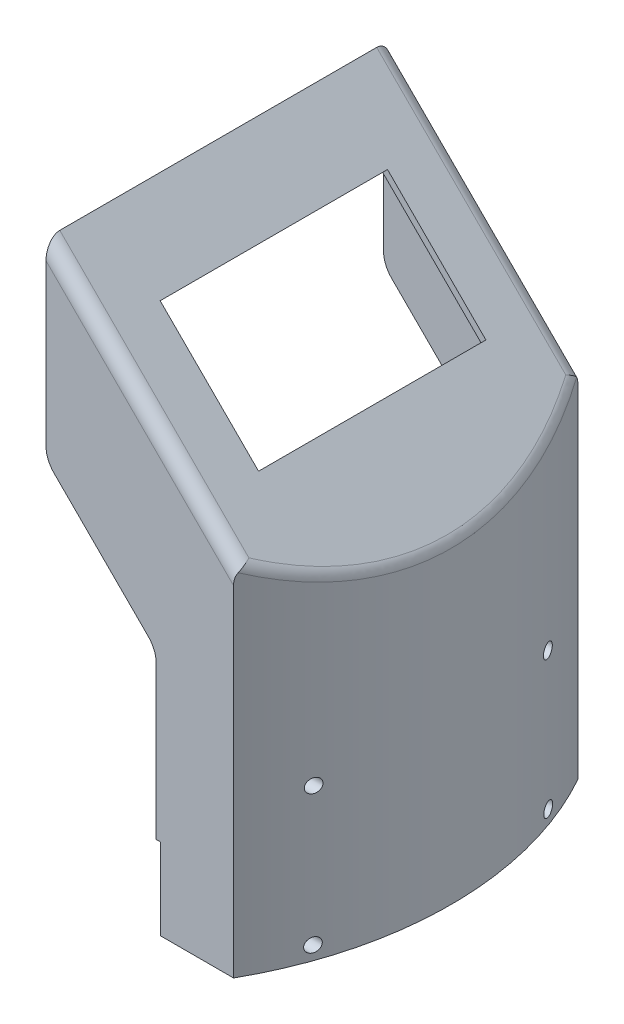
from build123d import *
from build123d.topology import SkipClean

# Parameters (mm, degrees)
SKETCH1_R            = 254.5
SKETCH1_R_2          = 234.5
BOSS_EXTRUDE1_DEPTH  = 5
BOSS_EXTRUDE2_DEPTH  = 500
SKETCH3_W            = 27.805822748
SKETCH3_H            = 60
CUT_EXTRUDE1_DEPTH   = 500
SKETCH4_R            = 250.5
CUT_EXTRUDE2_DEPTH   = 500
BOSS_EXTRUDE3_DEPTH  = 500
BOSS_EXTRUDE4_DEPTH  = 5
SKETCH11_W           = 24.416490723
SKETCH11_H           = 190
CUT_EXTRUDE3_DEPTH   = 10
CUT_EXTRUDE4_DEPTH   = 10
FILLET1_R            = 5
SKETCH15_R           = 2.5
CUT_EXTRUDE5_DEPTH   = 10
BOSS_EXTRUDE5_DEPTH  = 3
SKETCH18_R           = 2.5
CUT_EXTRUDE6_DEPTH   = 5
CUT_EXTRUDE7_DEPTH   = 7
FILLET2_R            = 5
SKETCH21_R           = 2.5
CUT_EXTRUDE8_DEPTH   = 10
SKETCH24_W           = 28.197779234
SKETCH24_H           = 25
CUT_EXTRUDE11_DEPTH  = 45
FILLET3_R            = 2
SKETCH25_R           = 315.993066883
CUT_EXTRUDE12_DEPTH  = 277
BOSS_EXTRUDE6_START  = -150
BOSS_EXTRUDE6_DEPTH  = 150
BOSS_EXTRUDE8_DEPTH  = 228
BOSS_EXTRUDE9_DEPTH  = 125
CUT_EXTRUDE15_DEPTH  = 250
SKETCH35_R           = 2.5
CUT_EXTRUDE16_DEPTH  = 10
CUT_EXTRUDE18_DEPTH  = 120
CUT_EXTRUDE19_DEPTH  = 369
BOSS_EXTRUDE10_DEPTH = 228
SKETCH36_R           = 5
CUT_EXTRUDE17_DEPTH  = 110
FILLET5_R            = 10
FILLET7_R            = 10
SKETCH43_W           = 165
SKETCH43_H           = 101
CUT_EXTRUDE20_DEPTH  = 10
FILLET8_R            = 10
BOSS_EXTRUDE12_DEPTH = 5
FILLET9_R            = 20
SKETCH46_W           = 3
SKETCH46_H           = 59
CUT_EXTRUDE21_DEPTH  = 5


with BuildPart() as part:
    # Sketch1 → Boss-Extrude1 (new body)
    with BuildSketch(Plane(origin=(0, 0, 0), x_dir=(1, 0, 0), z_dir=(0, 1, 0))):
        Circle(SKETCH1_R)
        Circle(SKETCH1_R_2, mode=Mode.SUBTRACT)
    extrude(amount=BOSS_EXTRUDE1_DEPTH)

    # Sketch2 → Boss-Extrude2 (add)
    with SkipClean():  # the faces are left unmerged after this step: merging them gives an invalid solid
        with BuildSketch(Plane(origin=(0, 5, 0), x_dir=(1, 0, 0), z_dir=(0, 1, 0))):
            with BuildLine():
                Line((234.5, 0), (254.5, 0))
                ThreePointArc((254.5, 0), (246.16017417, 64.617479467), (221.687279743, 125))
                Line((221.687279743, 125), (198.406779118, 125))
                ThreePointArc((198.406779118, 125), (225.296071541, 65.053286992), (234.5, 0))
            make_face()
        boss_extrude2 = extrude(amount=BOSS_EXTRUDE2_DEPTH)

    # Mirror1: Boss-Extrude2 across plane
    add(boss_extrude2.mirror(Plane(origin=(0, 505, 0), x_dir=(1, 0, 0), z_dir=(0, 0, 1))))

    # Sketch3 → Cut-Extrude1 (cut)
    with SkipClean():  # the faces are left unmerged after this step: merging them gives an invalid solid
        with BuildSketch(Plane(origin=(0, 5, 0), x_dir=(1, 0, 0), z_dir=(0, 1, 0))):
            with Locations((-240.597088626, 30)):
                Rectangle(SKETCH3_W, SKETCH3_H)
        cut_extrude1 = extrude(amount=-CUT_EXTRUDE1_DEPTH, mode=Mode.SUBTRACT)

    # Mirror2: Cut-Extrude1 across plane
    with SkipClean():  # the faces are left unmerged after this step: merging them gives an invalid solid
        add(cut_extrude1.mirror(Plane.XY), mode=Mode.SUBTRACT)

    # Sketch4 → Cut-Extrude2 (cut)
    with BuildSketch(Plane(origin=(0, 505, 0), x_dir=(1, 0, 0), z_dir=(0, 1, 0))):
        Circle(SKETCH4_R)
    extrude(amount=-CUT_EXTRUDE2_DEPTH, mode=Mode.SUBTRACT)

    # Sketch8 → Boss-Extrude3 (add)
    with BuildSketch(Plane(origin=(0, 5, 0), x_dir=(1, 0, 0), z_dir=(0, 1, 0))):
        Polygon((217.083509277, 125), (165.583509277, 125), (165.583509277, 120), (220.045796136, 120), (220.045796136, 125), align=None)
    boss_extrude3 = extrude(amount=BOSS_EXTRUDE3_DEPTH)

    # Mirror3: Boss-Extrude3 across plane
    add(boss_extrude3.mirror(Plane.XY))

    # Sketch10 → Boss-Extrude4 (add)
    with BuildSketch(Plane.XZ):
        with BuildLine():
            Line((198.406779118, 125), (165.583509277, 125))
            Line((165.583509277, 125), (165.583509277, -125))
            Line((165.583509277, -125), (198.406779118, -125))
            ThreePointArc((198.406779118, -125), (234.5, 0), (198.406779118, 125))
        make_face()
    extrude(amount=-BOSS_EXTRUDE4_DEPTH)

    # Sketch11 → Cut-Extrude3 (cut)
    with BuildSketch(Plane(origin=(0, 5, 0), x_dir=(1, 0, 0), z_dir=(0, 1, 0))):
        with Locations((177.791754639, -1.5)):
            Rectangle(SKETCH11_W, SKETCH11_H)
    extrude(amount=-CUT_EXTRUDE3_DEPTH, mode=Mode.SUBTRACT)

    # Sketch12 → Cut-Extrude4 (cut)
    with BuildSketch(Plane(origin=(0, 5, 0), x_dir=(1, 0, 0), z_dir=(0, 1, 0))):
        with BuildLine():
            Line((213, -75), (190, -75))
            Line((190, -75), (190, -93.5))
            Line((190, -93.5), (213, -93.5))
            ThreePointArc((213, -93.5), (216.535533906, -92.035533906), (218, -88.5))
            Line((218, -88.5), (218, -80))
            ThreePointArc((218, -80), (216.535533906, -76.464466094), (213, -75))
        make_face()
        with BuildLine():
            Line((213, 93.5), (190, 93.5))
            Line((190, 93.5), (190, 75))
            Line((190, 75), (213, 75))
            ThreePointArc((213, 75), (216.535533906, 76.464466094), (218, 80))
            Line((218, 80), (218, 88.5))
            ThreePointArc((218, 88.5), (216.535533906, 92.035533906), (213, 93.5))
        make_face()
        with BuildLine():
            Line((185, 120), (165.583509277, 120))
            Line((165.583509277, 120), (165.583509277, 93.5))
            Line((165.583509277, 93.5), (190, 93.5))
            Line((190, 93.5), (190, 115))
            ThreePointArc((190, 115), (188.535533906, 118.535533906), (185, 120))
        make_face()
        with BuildLine():
            Line((190, -115), (190, -96.5))
            Line((190, -96.5), (165.583509277, -96.5))
            Line((165.583509277, -96.5), (165.583509277, -120))
            Line((165.583509277, -120), (185, -120))
            ThreePointArc((185, -120), (188.535533906, -118.535533906), (190, -115))
        make_face()
    extrude(amount=-CUT_EXTRUDE4_DEPTH, mode=Mode.SUBTRACT)

    # Fillet1
    fillet1_edges = [part.edges().sort_by_distance(p)[0] for p in [
        (190, 2.5, 93.5),
        (190, 2.5, -93.5),
        (190, 2.5, -75),
        (190, 2.5, 75),
    ]]
    fillet(fillet1_edges, radius=FILLET1_R)

    # Sketch15 → Cut-Extrude5 (cut)
    with BuildSketch(Plane(origin=(0, 5, 0), x_dir=(1, 0, 0), z_dir=(0, 1, 0))):
        with Locations((242.5, 0)):
            Circle(SKETCH15_R)
        with Locations((196.186621136, -142.537923681)):
            Circle(SKETCH15_R)
        with Locations((74.936621136, -230.631205202)):
            Circle(SKETCH15_R)
        with Locations((-74.936621136, -230.631205202)):
            Circle(SKETCH15_R)
        with Locations((-196.186621136, -142.537923681)):
            Circle(SKETCH15_R)
        with Locations((-242.5, 0)):
            Circle(SKETCH15_R)
        with Locations((-196.186621136, 142.537923681)):
            Circle(SKETCH15_R)
        with Locations((-74.936621136, 230.631205202)):
            Circle(SKETCH15_R)
        with Locations((74.936621136, 230.631205202)):
            Circle(SKETCH15_R)
        with Locations((196.186621136, 142.537923681)):
            Circle(SKETCH15_R)
    extrude(amount=-CUT_EXTRUDE5_DEPTH, mode=Mode.SUBTRACT)

    # Sketch16 → Boss-Extrude5 (add)
    with BuildSketch(Plane(origin=(0, 5, 0), x_dir=(1, 0, 0), z_dir=(0, 1, 0))):
        with BuildLine():
            Line((-247.326201604, 60), (-244.238101041, 60))
            ThreePointArc((-244.238101041, 60), (-35.003834494, 249.052166364), (218.236683443, 125))
            Line((218.236683443, 125), (221.687279743, 125))
            ThreePointArc((221.687279743, 125), (-34.936922855, 252.090581779), (-247.326201604, 60))
        make_face()
        with BuildLine():
            Line((221.687279743, -125), (218.236683443, -125))
            ThreePointArc((218.236683443, -125), (-35.003834494, -249.052166364), (-244.238101041, -60))
            Line((-244.238101041, -60), (-247.326201604, -60))
            ThreePointArc((-247.326201604, -60), (-34.936922855, -252.090581779), (221.687279743, -125))
        make_face()
    extrude(amount=BOSS_EXTRUDE5_DEPTH)

    # Sketch18 → Cut-Extrude6 (cut)
    with BuildSketch(Plane(origin=(0, 5, 0), x_dir=(1, 0, 0), z_dir=(0, 1, 0))):
        with Locations((0, -242.5)):
            Circle(SKETCH18_R)
        with Locations((-142.537923681, -196.186621136)):
            Circle(SKETCH18_R)
        with Locations((-230.631205202, -74.936621136)):
            Circle(SKETCH18_R)
        with Locations((-230.631205202, 74.936621136)):
            Circle(SKETCH18_R)
        with Locations((-142.537923681, 196.186621136)):
            Circle(SKETCH18_R)
        with Locations((0, 242.5)):
            Circle(SKETCH18_R)
        with Locations((142.537923681, 196.186621136)):
            Circle(SKETCH18_R)
        with Locations((230.631205202, 74.936621136)):
            Circle(SKETCH18_R)
        with Locations((230.631205202, -74.936621136)):
            Circle(SKETCH18_R)
        with Locations((142.537923681, -196.186621136)):
            Circle(SKETCH18_R)
    extrude(amount=-CUT_EXTRUDE6_DEPTH, mode=Mode.SUBTRACT)

    # Sketch19 → Cut-Extrude7 (cut)
    with BuildSketch(Plane.XZ):
        with BuildLine():
            Line((193, 20), (207, 20))
            ThreePointArc((207, 20), (209.121320344, 19.121320344), (210, 17))
            Line((210, 17), (210, -17))
            ThreePointArc((210, -17), (209.121320344, -19.121320344), (207, -20))
            Line((207, -20), (193, -20))
            Line((193, -20), (190, -20))
            Line((190, -20), (190, -17))
            Line((190, -17), (190, 17))
            Line((190, 17), (190, 20))
            Line((190, 20), (193, 20))
        make_face()
    extrude(amount=-CUT_EXTRUDE7_DEPTH, mode=Mode.SUBTRACT)

    # Fillet2
    fillet2_edges = [part.edges().sort_by_distance(p)[0] for p in [
        (190, 2.5, 20),
        (190, 2.5, -20),
    ]]
    fillet(fillet2_edges, radius=FILLET2_R)

    # Sketch21 → Cut-Extrude8 (cut)
    with BuildSketch(Plane(origin=(0, 5, 0), x_dir=(1, 0, 0), z_dir=(0, 1, 0))):
        with Locations((200, 50)):
            Circle(SKETCH21_R)
        with Locations((200, -50)):
            Circle(SKETCH21_R)
    extrude(amount=-CUT_EXTRUDE8_DEPTH, mode=Mode.SUBTRACT)

    # Sketch24 → Cut-Extrude11 (cut, symmetric)
    with BuildSketch(Plane.XY):
        with Locations((254.5, 246.5)):
            Rectangle(SKETCH24_W, SKETCH24_H)
    extrude(amount=CUT_EXTRUDE11_DEPTH, both=True, mode=Mode.SUBTRACT)

    # Fillet3
    fillet3_edges = [part.edges().sort_by_distance(p)[0] for p in [
        (248.457478811, 259, 45),
        (248.457478811, 234, 45),
        (248.457478811, 234, -45),
        (248.457478811, 259, -45),
    ]]
    fillet(fillet3_edges, radius=FILLET3_R)

    # Sketch25 → Cut-Extrude12 (cut)
    with BuildSketch(Plane.XZ):
        Circle(SKETCH25_R)
    extrude(amount=-CUT_EXTRUDE12_DEPTH, mode=Mode.SUBTRACT)

    # Sketch26 → Boss-Extrude6 (add)
    with BuildSketch(Plane.XZ.offset(-277).offset(BOSS_EXTRUDE6_START)):
        with BuildLine():
            Line((188.583509277, -60), (188.583509277, -120))
            Line((188.583509277, -120), (219.886902748, -120))
            ThreePointArc((219.886902748, -120), (233.482930338, -90.752251987), (243.208244104, -60))
            Line((243.208244104, -60), (188.583509277, -60))
        make_face()
        with BuildLine():
            ThreePointArc((243.208244104, 60), (233.482930338, 90.752251987), (219.886902748, 120))
            Line((219.886902748, 120), (188.583509277, 120))
            Line((188.583509277, 120), (188.583509277, 60))
            Line((188.583509277, 60), (243.208244104, 60))
        make_face()
    extrude(amount=BOSS_EXTRUDE6_DEPTH)

    # Sketch30 → Boss-Extrude8 (add)
    with BuildSketch(Plane(origin=(0, 505, 0), x_dir=(1, 0, 0), z_dir=(0, 1, 0))):
        with BuildLine():
            ThreePointArc((219.886902748, -120), (250.5, 0), (219.886902748, 120))
            Line((219.886902748, 120), (217.605721432, 120))
            ThreePointArc((217.605721432, 120), (217.869046713, 119.521247), (218.131318694, 119.041916168))
            ThreePointArc((218.131318694, 119.041916168), (240.788166959, 61.427263103), (248.5, 0))
            ThreePointArc((248.5, 0), (240.788166959, -61.427263103), (218.131318694, -119.041916168))
            ThreePointArc((218.131318694, -119.041916168), (217.869046713, -119.521247), (217.605721432, -120))
            Line((217.605721432, -120), (219.886902748, -120))
        make_face()
    extrude(amount=-BOSS_EXTRUDE8_DEPTH)

    # Sketch33 → Boss-Extrude9 (add, symmetric)
    with BuildSketch(Plane.XY):
        Polygon((254.5, 505), (85.583509277, 673.916490723), (85.583509277, 505), (165.583509277, 505), align=None)
    extrude(amount=BOSS_EXTRUDE9_DEPTH, both=True)

    # Sketch34 → Cut-Extrude15 (cut)
    with BuildSketch(Plane(origin=(0, 505, 0), x_dir=(-1, 0, 0), z_dir=(0, -1, 0))):
        with BuildLine():
            Line((-254.5, -125), (-221.687279743, -125))
            ThreePointArc((-221.687279743, -125), (-246.16017417, -64.617479467), (-254.5, 0))
            Line((-254.5, 0), (-254.5, -125))
        make_face()
        with BuildLine():
            ThreePointArc((-254.5, 0), (-246.16017417, 64.617479467), (-221.687279743, 125))
            Line((-221.687279743, 125), (-254.5, 125))
            Line((-254.5, 125), (-254.5, 0))
        make_face()
    extrude(amount=-CUT_EXTRUDE15_DEPTH, mode=Mode.SUBTRACT)

    # Sketch35 → Cut-Extrude16 (cut)
    with BuildSketch(Plane.ZY.offset(-188.583509277)):
        with Locations((-85, 386.999350532)):
            Circle(SKETCH35_R)
        with Locations((-85.360407062, 287)):
            Circle(SKETCH35_R)
        with Locations((85.360407062, 287)):
            Circle(SKETCH35_R)
        with Locations((85, 386.999350532)):
            Circle(SKETCH35_R)
    extrude(amount=-CUT_EXTRUDE16_DEPTH, mode=Mode.SUBTRACT)

    # Sketch37 → Cut-Extrude18 (cut, symmetric)
    with BuildSketch(Plane.XY):
        Polygon((217.605721432, 534.823210756), (85.583509277, 666.845422911), (85.583509277, 505), (217.605721432, 505), align=None)
    extrude(amount=CUT_EXTRUDE18_DEPTH, both=True, mode=Mode.SUBTRACT)

    # Sketch40 → Cut-Extrude19 (cut)
    with BuildSketch(Plane(origin=(0, 0, -125), x_dir=(-1, 0, 0), z_dir=(0, 0, -1))):
        Polygon((-165.583509277, 505), (-85.583509277, 585), (-85.583509277, 505), align=None)
    extrude(amount=-CUT_EXTRUDE19_DEPTH, mode=Mode.SUBTRACT)

    # Sketch41 → Boss-Extrude10 (add)
    with BuildSketch(Plane.XZ.offset(-505)):
        with BuildLine():
            ThreePointArc((248.5, 0), (240.65252105, 61.956550195), (217.605721432, 120))
            Line((217.605721432, 120), (217.605721432, -120))
            ThreePointArc((217.605721432, -120), (240.65252105, -61.956550195), (248.5, 0))
        make_face()
    extrude(amount=BOSS_EXTRUDE10_DEPTH)

    # Sketch36 → Cut-Extrude17 (cut)
    with BuildSketch(Plane.ZY.offset(-198.583509277)):
        with Locations((-85, 386.999350532)):
            Circle(SKETCH36_R)
        with Locations((-85.360407062, 287)):
            Circle(SKETCH36_R)
        with Locations((85.360407062, 287)):
            Circle(SKETCH36_R)
        with Locations((85, 386.999350532)):
            Circle(SKETCH36_R)
    extrude(amount=-CUT_EXTRUDE17_DEPTH, mode=Mode.SUBTRACT)

    # Fillet5
    fillet5_edges = [part.edges().sort_by_distance(p)[0] for p in [
        (217.605721432, 534.823210756, 0),
    ]]
    fillet(fillet5_edges, radius=FILLET5_R)

    # Fillet7
    fillet7_edges = [part.edges().sort_by_distance(p)[0] for p in [
        (153.63539451, 605.86460549, 125),
        (245.679250791, 513.820749209, -66.422554382),
        (153.63539451, 605.86460549, -125),
    ]]
    fillet(fillet7_edges, radius=FILLET7_R)

    # Sketch43 → Cut-Extrude20 (cut)
    with BuildSketch(Plane(origin=(376.214466094, 376.214466094, 0), x_dir=(0, 0, 1), z_dir=(-0.7071067811865479, -0.7071067811865472, 0))):
        with Locations((0, 308.448773436)):
            Rectangle(SKETCH43_W, SKETCH43_H)
    extrude(amount=-CUT_EXTRUDE20_DEPTH, mode=Mode.SUBTRACT)

    # Fillet8
    fillet8_edges = [part.edges().sort_by_distance(p)[0] for p in [
        (217.605721432, 478.840537566, 120),
        (216.844516757, 534.507909456, 120),
        (217.605721432, 478.840537566, -120),
        (216.844516757, 534.507909456, -120),
        (150.13014926, 602.298782928, 120),
        (150.13014926, 602.298782928, -120),
    ]]
    fillet(fillet8_edges, radius=FILLET8_R)

    # Sketch44 → Boss-Extrude12 (add)
    with BuildSketch(Plane(origin=(0, 0, -125), x_dir=(-1, 0, 0), z_dir=(0, 0, -1))):
        Polygon((-85.583509277, 585), (-165.583509277, 505), (-165.583509277, 455), (-85.583509277, 535), align=None)
    boss_extrude12 = extrude(amount=-BOSS_EXTRUDE12_DEPTH)

    # Mirror6: Boss-Extrude12 across plane
    add(boss_extrude12.mirror(Plane.XY))

    # Fillet9
    fillet9_edges = [part.edges().sort_by_distance(p)[0] for p in [
        (165.583509277, 455, 122.5),
        (85.583509277, 535, 122.5),
        (165.583509277, 455, -122.5),
        (85.583509277, 535, -122.5),
    ]]
    fillet(fillet9_edges, radius=FILLET9_R)

    # Sketch46 → Cut-Extrude21 (cut)
    with BuildSketch(Plane(origin=(0, 0, -125), x_dir=(-1, 0, 0), z_dir=(0, 0, -1))):
        with Locations((-167.083509277, 306.5)):
            Rectangle(SKETCH46_W, SKETCH46_H)
    cut_extrude21 = extrude(amount=-CUT_EXTRUDE21_DEPTH, mode=Mode.SUBTRACT)

    # Mirror7: Cut-Extrude21 across plane
    add(cut_extrude21.mirror(Plane.XY), mode=Mode.SUBTRACT)


solid = part.part
